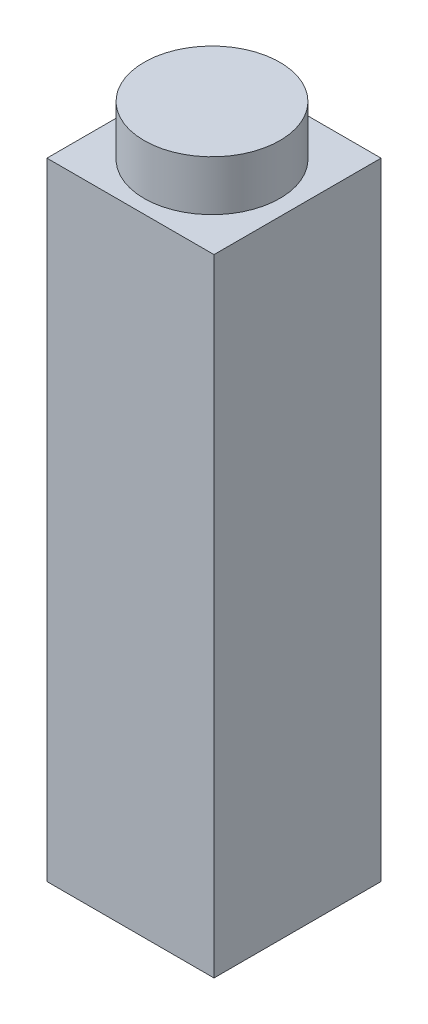
from build123d import *

# Parameters (mm, degrees)
SKETCH1_W           = 4
SKETCH1_H           = 4
BOSS_EXTRUDE1_DEPTH = 15
SKETCH2_R           = 1
CUT_EXTRUDE1_DEPTH  = 0.5
SKETCH4_R           = 1.625
BOSS_EXTRUDE2_DEPTH = 1.2


with BuildPart() as part:
    # Sketch1 → Boss-Extrude1 (new body)
    with BuildSketch(Plane(origin=(0, 0, 0), x_dir=(1, 0, 0), z_dir=(0, 1, 0))):
        Rectangle(SKETCH1_W, SKETCH1_H)
    extrude(amount=BOSS_EXTRUDE1_DEPTH)

    # Sketch2 → Cut-Extrude1 (cut)
    with BuildSketch(Plane.XZ):
        Circle(SKETCH2_R)
    extrude(amount=-CUT_EXTRUDE1_DEPTH, mode=Mode.SUBTRACT)

    # Sketch4 → Boss-Extrude2 (add)
    with BuildSketch(Plane(origin=(0, 15, 0), x_dir=(1, 0, 0), z_dir=(0, 1, 0))):
        with Locations((0, -0.04771887)):
            Circle(SKETCH4_R)
    extrude(amount=BOSS_EXTRUDE2_DEPTH)


solid = part.part
